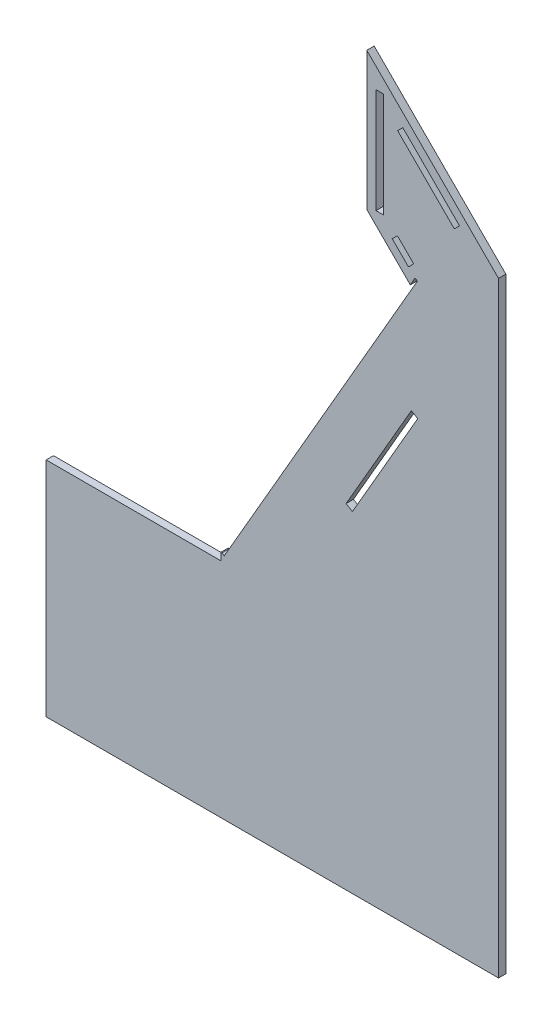
from build123d import *

# Parameters (mm, degrees)
SKETCH1_W           = 8
SKETCH1_H           = 113.93
BOSS_EXTRUDE1_DEPTH = 8


with BuildPart() as part:
    # Sketch1 → Boss-Extrude1 (new body)
    with BuildSketch(Plane.XY):
        Polygon((0, 242), (0, 0), (492, 0), (492, 658.949580676), (348.752525317, 802.197055359), (348.752525317, 652.197055359), (396.053847577, 604.895733099), (401.153525404, 613.728634197), (403.751601615, 612.228634197), (193.751601615, 248.497964607), (191.15, 250), (190, 250), (190, 242), align=None)
        Polygon((404.143252861, 482.906994054), (333.143252861, 359.931386716), (326.215049631, 363.931386716), (397.215049631, 486.906994054), align=None, mode=Mode.SUBTRACT)
        with Locations((362.727118533, 713.120041068)):
            Rectangle(SKETCH1_W, SKETCH1_H, mode=Mode.SUBTRACT)
        Polygon((394.082457592, 620.799702009), (376.404788062, 638.477371538), (382.061642312, 644.134225788), (399.739311841, 626.456556258), align=None, mode=Mode.SUBTRACT)
        Polygon((443.914894767, 681.583556335), (382.283467719, 743.214983383), (387.940321968, 748.871837632), (449.571749016, 687.240410584), align=None, mode=Mode.SUBTRACT)
    extrude(amount=BOSS_EXTRUDE1_DEPTH)


solid = part.part
